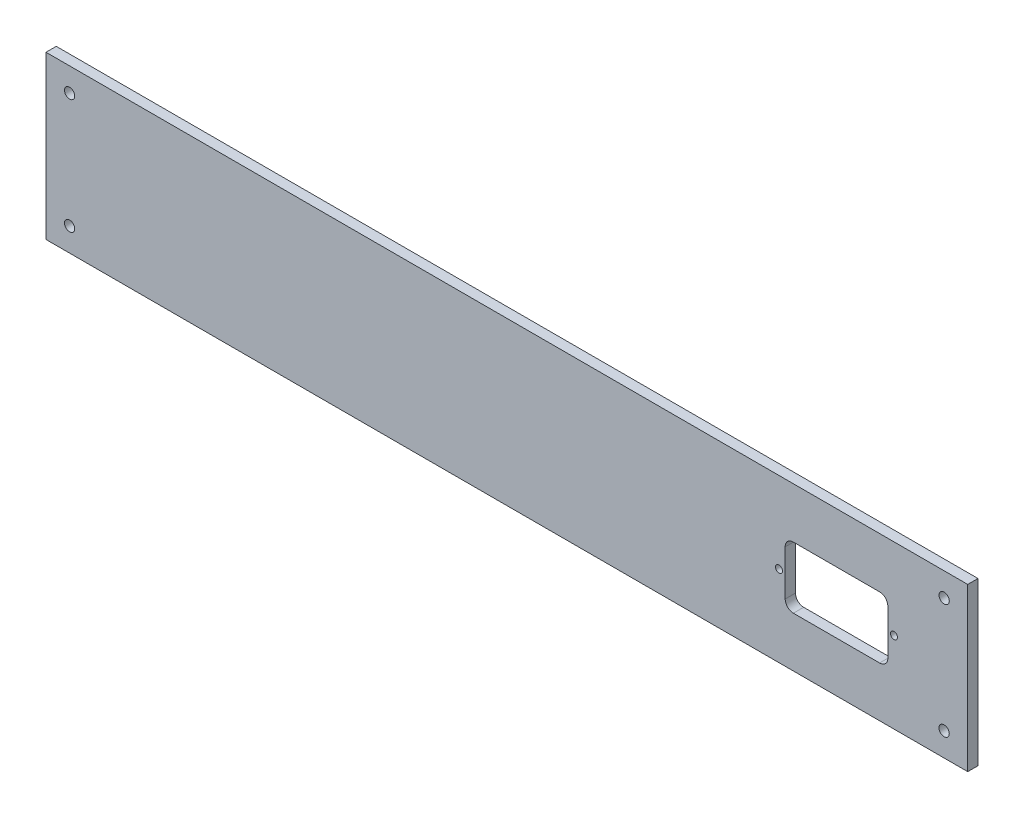
from build123d import *

# Parameters (mm, degrees)
SKETCH_F_W                   = 449
SKETCH_F_H                   = 79
SKETCH_F_R                   = 2.5
ESTRUSIONE_ESTRUSIONE1_DEPTH = 5
SKETCH1_R                    = 1.7
EXTRUDE1_DEPTH               = 456.924335828


with BuildPart() as part:
    # Sketch f → Estrusione-Estrusione1 (new body)
    with BuildSketch(Plane.XY):
        with Locations((224.5, 39.5)):
            Rectangle(SKETCH_F_W, SKETCH_F_H)
        with Locations((11.5, 67.5)):
            Circle(SKETCH_F_R, mode=Mode.SUBTRACT)
        with Locations((437.5, 67.5)):
            Circle(SKETCH_F_R, mode=Mode.SUBTRACT)
        with Locations((11.5, 11.5)):
            Circle(SKETCH_F_R, mode=Mode.SUBTRACT)
        with Locations((437.5, 11.5)):
            Circle(SKETCH_F_R, mode=Mode.SUBTRACT)
    extrude(amount=ESTRUSIONE_ESTRUSIONE1_DEPTH)

    # Sketch1 → Extrude1 (cut, through all)
    with BuildSketch(Plane(origin=(0, 0, 0), x_dir=(-1, 0, 0), z_dir=(0, 0, -1))):
        with Locations((-413.061242298, 39.505506417)):
            Circle(SKETCH1_R)
        with Locations((-357.061242298, 39.505506417)):
            Circle(SKETCH1_R)
        with BuildLine():
            Line((-364.0746338, 54.394920259), (-406.0746338, 54.394920259))
            ThreePointArc((-406.0746338, 54.394920259), (-408.903060925, 53.223347384), (-410.0746338, 50.394920259))
            Line((-410.0746338, 50.394920259), (-410.0746338, 28.394920259))
            ThreePointArc((-410.0746338, 28.394920259), (-408.903060925, 25.566493134), (-406.0746338, 24.394920259))
            Line((-406.0746338, 24.394920259), (-364.0746338, 24.394920259))
            ThreePointArc((-364.0746338, 24.394920259), (-361.246206675, 25.566493134), (-360.0746338, 28.394920259))
            Line((-360.0746338, 28.394920259), (-360.0746338, 50.394920259))
            ThreePointArc((-360.0746338, 50.394920259), (-361.246206675, 53.223347384), (-364.0746338, 54.394920259))
        make_face()
    extrude(amount=-EXTRUDE1_DEPTH, mode=Mode.SUBTRACT)


solid = part.part
